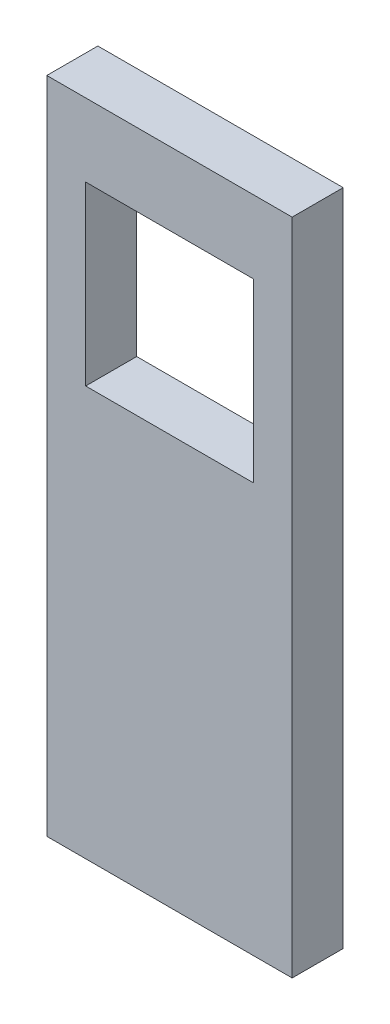
from build123d import *

# Parameters (mm, degrees)
SKETCH1_W           = 17.08
SKETCH1_H           = 18
BOSS_EXTRUDE1_DEPTH = 2.6


with BuildPart() as part:
    # Sketch1 → Boss-Extrude1 (new, symmetric)
    with BuildSketch(Plane.XY):
        Polygon((0, 67.15), (0, 44.75), (0, 39.55), (0, 27.6), (0, 22.4), (0, 0), (25, 0), (25, 22.4), (25, 27.6), (25, 39.55), (25, 44.75), (25, 67.15), align=None)
        with Locations((12.5, 50.725)):
            Rectangle(SKETCH1_W, SKETCH1_H, mode=Mode.SUBTRACT)
    extrude(amount=BOSS_EXTRUDE1_DEPTH, both=True)


solid = part.part
